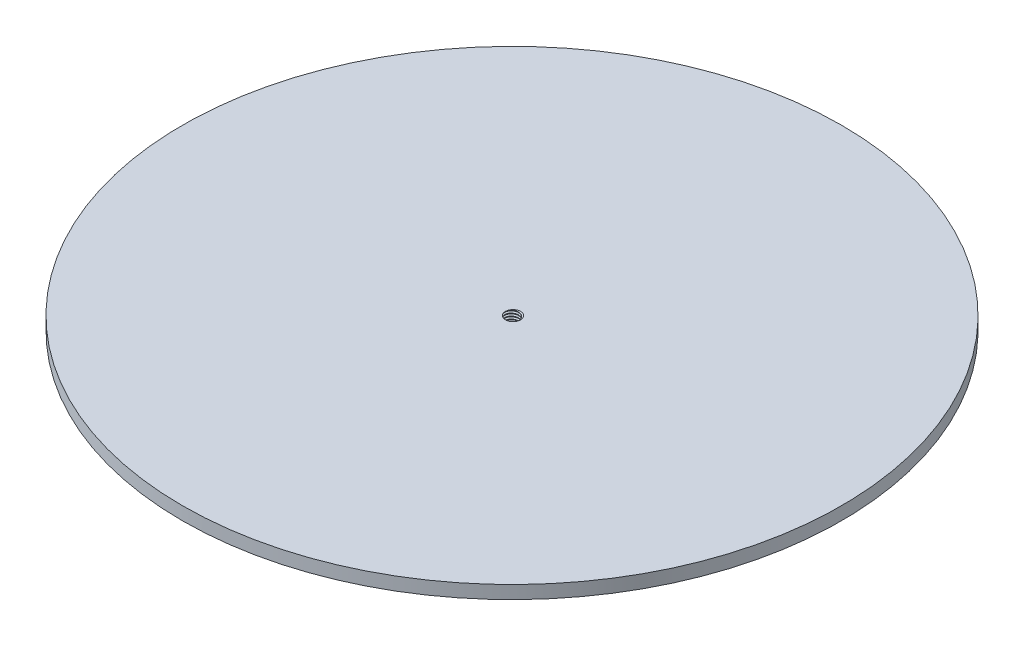
from build123d import *

# Parameters (mm, degrees)
SKETCH1_R           = 160
BOSS_EXTRUDE1_DEPTH = 6.35
SKETCH7_R           = 3.323417653
CUT_EXTRUDE1_DEPTH  = 227.363253422
CUT_SWEEP1_PITCH    = 1.25


with BuildPart() as part:
    # Sketch1 → Boss-Extrude1 (new body)
    with BuildSketch(Plane(origin=(0, 0, 0), x_dir=(1, 0, 0), z_dir=(0, 1, 0))):
        with Locations(Location((0, 0, 0), (0, 0, 270))):
            Circle(SKETCH1_R)
    extrude(amount=BOSS_EXTRUDE1_DEPTH)

    # Sketch7 → Cut-Extrude1 (cut, through all)
    with BuildSketch(Plane.XZ):
        with Locations(Location((0, 0, 0), (0, 0, 270))):
            Circle(SKETCH7_R)
    extrude(amount=-CUT_EXTRUDE1_DEPTH, mode=Mode.SUBTRACT)

    # Cut-Sweep1: the profile of Sketch10 screwed along a right-hand helix of 7 turns, 8 arcs to a turn; built about Z, then put on its axis
    cut_sweep1_z = Axis((0, 0, 0), (0, 0, 1))
    cut_sweep1_corners = [(0, 3.185608831, -0.076686039), (0, 4, -0.546875), (0, 4, -0.703125), (0, 3.185608831, -1.173313961)]
    with BuildLine(mode=Mode.PRIVATE) as cut_sweep1_profile:
        Line(cut_sweep1_corners[0], cut_sweep1_corners[1])
        Line(cut_sweep1_corners[1], cut_sweep1_corners[2])
        Line(cut_sweep1_corners[2], cut_sweep1_corners[3])
        Line(cut_sweep1_corners[3], cut_sweep1_corners[0])
    cut_sweep1_cap = Face(cut_sweep1_profile.wire())
    cut_sweep1_turn_angles = [0, 22.5, 45, 67.5, 90, 112.5, 135, 157.5, 180, 202.5, 225, 247.5, 270, 292.5, 315, 337.5, 360]
    cut_sweep1_turn_weights = [1, 0.9238795325112867, 1, 0.9238795325112867, 1, 0.9238795325112867, 1, 0.9238795325112867, 1, 0.9238795325112867, 1, 0.9238795325112867, 1, 0.9238795325112867, 1, 0.9238795325112867, 1]
    cut_sweep1_turn_rails = [Edge.make_bspline([Vector(p[0], p[1], 0).rotate(cut_sweep1_z, cut_sweep1_turn_angles[k]) / cut_sweep1_turn_weights[k] + Vector(0, 0, p[2] + CUT_SWEEP1_PITCH * cut_sweep1_turn_angles[k] / 360) for k in range(17)], [0, 0, 0, 1, 1, 2, 2, 3, 3, 4, 4, 5, 5, 6, 6, 7, 7, 8, 8, 8], 2, cut_sweep1_turn_weights) for p in cut_sweep1_corners]
    cut_sweep1_turn_sides = [Face.make_surface_from_curves(cut_sweep1_turn_rails[p[0]], cut_sweep1_turn_rails[p[1]]) for p in [(0, 1), (1, 2), (2, 3), (3, 0)]]
    cut_sweep1 = Plane(origin=(0, 0, 0), x_dir=(0, 0, -1), z_dir=(0, 1, 0)) * Solid(Shell([*[p.moved(Location((0, 0, CUT_SWEEP1_PITCH * i))) for i in range(7) for p in cut_sweep1_turn_sides], cut_sweep1_cap, cut_sweep1_cap.rotate(cut_sweep1_z, 2520).moved(Location((0, 0, CUT_SWEEP1_PITCH * 2520 / 360)))]))
    add(cut_sweep1, mode=Mode.SUBTRACT)


solid = part.part
